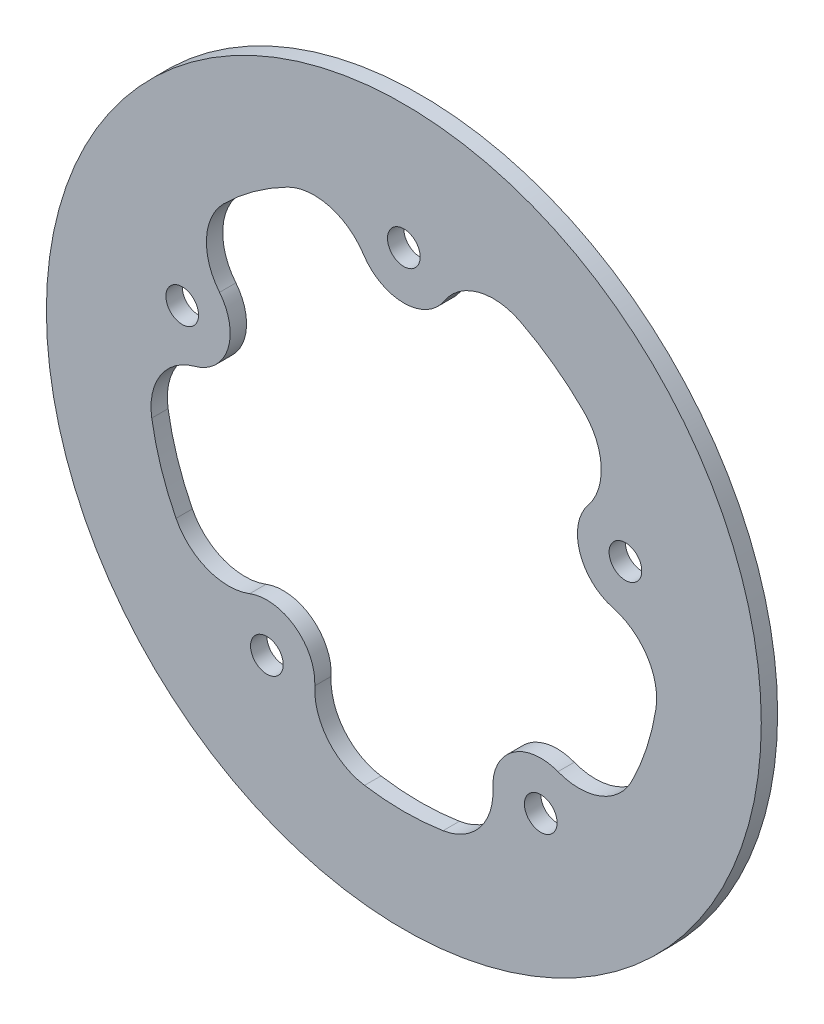
from build123d import *

# Parameters (mm, degrees)
SKETCH1_R           = 44.45
SKETCH1_R_2         = 2.032
BOSS_EXTRUDE1_DEPTH = 2.032


with BuildPart() as part:
    # Sketch1 → Boss-Extrude1 (new body)
    with BuildSketch(Plane.XY):
        Circle(SKETCH1_R)
        with BuildLine():
            ThreePointArc((14.489973866, 28.25071959), (18.66218176, 25.686289571), (22.390382784, 22.510736523))
            ThreePointArc((22.390382784, 22.510736523), (24.539863244, 17.709645742), (22.918532759, 12.705444867))
            ThreePointArc((22.918532759, 12.705444867), (21.882111596, 7.109929053), (26.009555605, 3.192254742))
            ThreePointArc((26.009555605, 3.192254742), (30.262634994, 0.096765339), (31.345679129, -5.050831609))
            ThreePointArc((31.345679129, -5.050831609), (30.196044392, -9.811289571), (28.327991447, -14.338319307))
            ThreePointArc((28.327991447, -14.338319307), (24.426108766, -17.866215349), (19.165812242, -17.87062154))
            ThreePointArc((19.165812242, -17.87062154), (13.523888712, -18.614035917), (11.073409372, -23.750096378))
            ThreePointArc((11.073409372, -23.750096378), (9.443697814, -28.751574078), (4.882721236, -31.372305196))
            ThreePointArc((4.882721236, -31.372305196), (0, -31.75), (-4.882721236, -31.372305196))
            ThreePointArc((-4.882721236, -31.372305196), (-9.443697814, -28.751574078), (-11.073409372, -23.750096378))
            ThreePointArc((-11.073409372, -23.750096378), (-13.523888712, -18.614035917), (-19.165812242, -17.87062154))
            ThreePointArc((-19.165812242, -17.87062154), (-24.426108766, -17.866215349), (-28.327991447, -14.338319307))
            ThreePointArc((-28.327991447, -14.338319307), (-30.196044392, -9.811289571), (-31.345679129, -5.050831609))
            ThreePointArc((-31.345679129, -5.050831609), (-30.262634994, 0.096765339), (-26.009555605, 3.192254742))
            ThreePointArc((-26.009555605, 3.192254742), (-21.882111596, 7.109929053), (-22.918532759, 12.705444867))
            ThreePointArc((-22.918532759, 12.705444867), (-24.539863244, 17.709645742), (-22.390382784, 22.510736523))
            ThreePointArc((-22.390382784, 22.510736523), (-18.66218176, 25.686289571), (-14.489973866, 28.25071959))
            ThreePointArc((-14.489973866, 28.25071959), (-9.259639202, 28.811378346), (-5.001380024, 25.723018309))
            ThreePointArc((-5.001380024, 25.723018309), (0, 23.008213729), (5.001380024, 25.723018309))
            ThreePointArc((5.001380024, 25.723018309), (9.259639202, 28.811378346), (14.489973866, 28.25071959))
        make_face(mode=Mode.SUBTRACT)
        with Locations((27.554523924, 8.953007543)):
            Circle(SKETCH1_R_2, mode=Mode.SUBTRACT)
        with Locations((0, 28.972541013)):
            Circle(SKETCH1_R_2, mode=Mode.SUBTRACT)
        with Locations((-27.554523924, 8.953007543)):
            Circle(SKETCH1_R_2, mode=Mode.SUBTRACT)
        with Locations((-17.029632329, -23.43927805)):
            Circle(SKETCH1_R_2, mode=Mode.SUBTRACT)
        with Locations((17.029632329, -23.43927805)):
            Circle(SKETCH1_R_2, mode=Mode.SUBTRACT)
    extrude(amount=BOSS_EXTRUDE1_DEPTH)


solid = part.part
